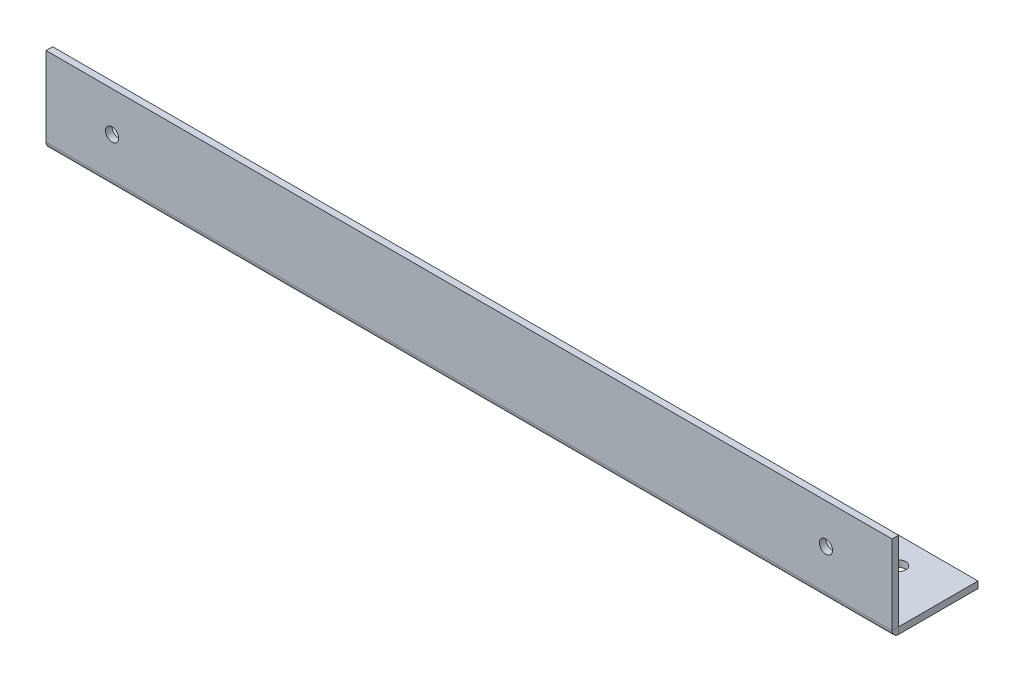
from build123d import *

# Parameters (mm, degrees)
BASE_FLANGE1_DEPTH = 406.4
SKETCH6_R          = 3.175
CUT_EXTRUDE1_DEPTH = 6.35
SKETCH7_R          = 3.429
CUT_EXTRUDE2_DEPTH = 6.35


# Read off the part's stored shape, not the designer's step: Base-Flange1
with BuildPart() as part:
    # Base-Flange1 outline → Base-Flange1 (new body)
    with BuildSketch(Plane(origin=(0, 0, 0), x_dir=(0, 0, -1), z_dir=(1, 0, 0))):
        with BuildLine():
            Line((0, -3.175), (38.1, -3.175))
            Line((38.1, -3.175), (38.1, 0))
            Line((38.1, 0), (0, 0))
            Line((0, 0), (0, 38.1))
            Line((0, 38.1), (-3.175, 38.1))
            Line((-3.175, 38.1), (-3.175, 0))
            ThreePointArc((-3.175, 0), (-2.24506403, -2.24506403), (0, -3.175))
        make_face()
    extrude(amount=BASE_FLANGE1_DEPTH)

    # Sketch6 → Cut-Extrude1 (cut)
    with BuildSketch(Plane.XY.offset(3.175)):
        with Locations((31.75, 19.05)):
            Circle(SKETCH6_R)
        with Locations((374.65, 19.05)):
            Circle(SKETCH6_R)
    extrude(amount=-CUT_EXTRUDE1_DEPTH, mode=Mode.SUBTRACT)

    # Sketch7 → Cut-Extrude2 (cut)
    with BuildSketch(Plane.XZ.offset(3.175)):
        with Locations(Location((25.4, -25.4, 0), (0, 0, 270))):
            Circle(SKETCH7_R)
        with Locations(Location((381, -25.4, 0), (0, 0, 270))):
            Circle(SKETCH7_R)
    extrude(amount=-CUT_EXTRUDE2_DEPTH, mode=Mode.SUBTRACT)


solid = part.part
